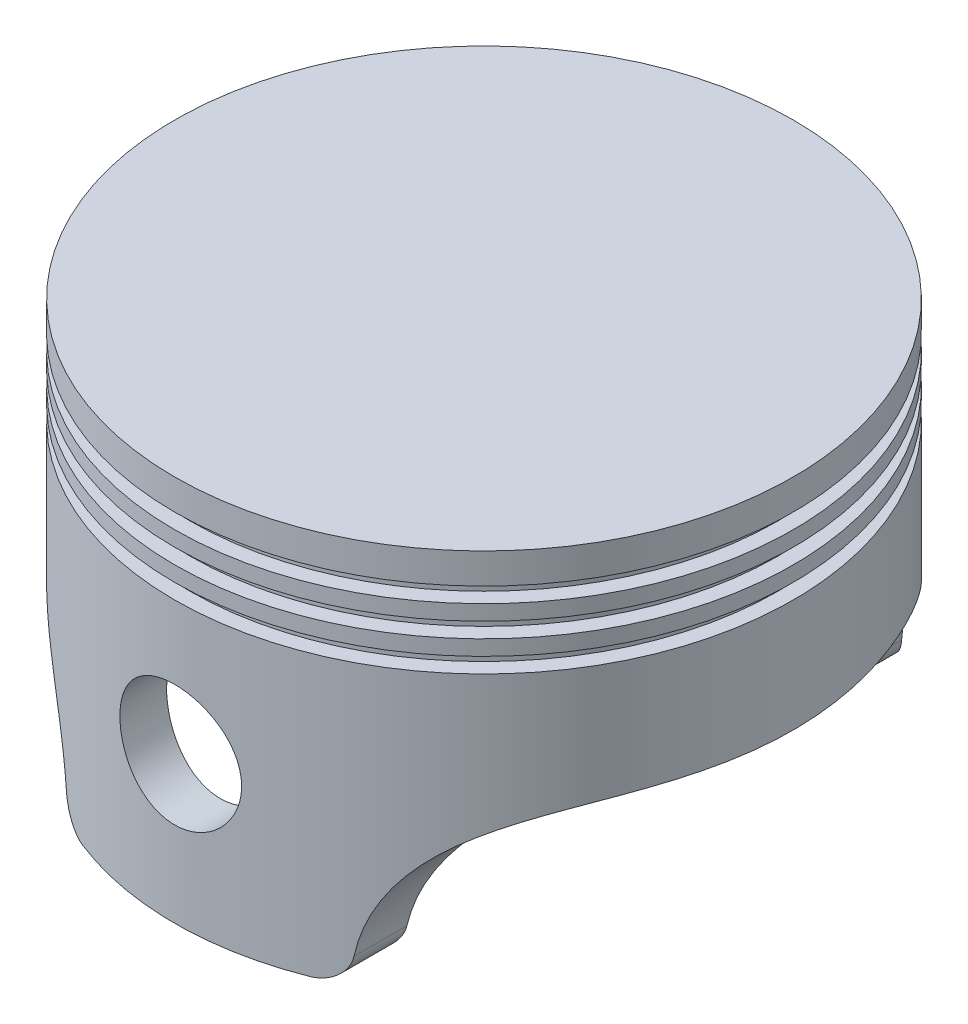
from build123d import *

# Parameters (mm, degrees)
SKETCH2_R           = 50.8
BOSS_EXTRUDE1_DEPTH = 31.75
SHELL1_T            = -7.5
BOSS_EXTRUDE5_DEPTH = 28.5
SKETCH6_R           = 10
CUT_EXTRUDE2_DEPTH  = 79.545162168
SKETCH8_W           = 2.5
SKETCH8_H           = 2.5
FILLET1_R           = 2
FILLET2_R           = 5


with BuildPart() as part:
    # Sketch2 → Boss-Extrude1 (new, symmetric)
    with BuildSketch(Plane(origin=(0, 0, 0), x_dir=(1, 0, 0), z_dir=(0, 1, 0))):
        Circle(SKETCH2_R)
    extrude(amount=BOSS_EXTRUDE1_DEPTH, both=True)

    # Shell1
    shell1_openings = [part.faces().sort_by_distance(p)[0] for p in [
        (0, -31.75, 0),
    ]]
    offset(amount=SHELL1_T, openings=shell1_openings, kind=Kind.INTERSECTION)

    # Sketch4 → Boss-Extrude5 (add)
    with BuildSketch(Plane.XZ.offset(-24.25)):
        with BuildLine():
            Line((-42.645515591, 7.5), (42.645515591, 7.5))
            ThreePointArc((42.645515591, 7.5), (42.125248373, 10.017656887), (41.456483208, 12.5))
            Line((41.456483208, 12.5), (-41.456483208, 12.5))
            ThreePointArc((-41.456483208, 12.5), (-42.125248373, 10.017656887), (-42.645515591, 7.5))
        make_face()
    boss_extrude5 = extrude(amount=BOSS_EXTRUDE5_DEPTH)

    # Mirror1: Boss-Extrude5 across plane
    add(boss_extrude5.mirror(Plane.XY))

    # Sketch6 → Cut-Extrude2 (cut, symmetric)
    with BuildSketch(Plane.XY):
        with Locations((0, -7.75)):
            Circle(SKETCH6_R)
        with BuildLine():
            Line((50.8, -31.75), (50.8, -4.25))
            ThreePointArc((50.8, -4.25), (31.354563517, -12.304563517), (23.3, -31.75))
            Line((23.3, -31.75), (50.8, -31.75))
        make_face()
    cut_extrude2 = extrude(amount=CUT_EXTRUDE2_DEPTH, both=True, mode=Mode.SUBTRACT)

    # Mirror2: Cut-Extrude2 across plane
    add(cut_extrude2.mirror(Plane(origin=(0, 0, 0), x_dir=(0, 0, 1), z_dir=(1, 0, 0))), mode=Mode.SUBTRACT)

    # Sketch8 → Cut-Revolve3 (revolve, cut)
    with BuildSketch(Plane.XY):
        with Locations((-49.55, 25.5)):
            Rectangle(SKETCH8_W, SKETCH8_H)
        with Locations((-49.55, 20.5)):
            Rectangle(SKETCH8_W, SKETCH8_H)
        with Locations((-49.55, 15.5)):
            Rectangle(SKETCH8_W, SKETCH8_H)
    revolve(axis=Axis((0, 0, 0), (0, 1, 0)), mode=Mode.SUBTRACT)

    # Fillet1
    fillet1_edges = [part.edges().sort_by_distance(p)[0] for p in [
        (0, 24.25, -43.3),
        (0, 24.25, 43.3),
        (-43.3, 24.25, 0),
        (43.13606858, 24.25, 3.764251248),
    ]]
    fillet(fillet1_edges, radius=FILLET1_R)

    # Fillet2
    fillet2_edges = [part.edges().sort_by_distance(p)[0] for p in [
        (-23.3, -31.75, -40.819009777),
        (23.3, -31.75, -40.819009777),
        (-23.3, -31.75, 40.819009777),
        (23.3, -31.75, 40.819009777),
    ]]
    fillet(fillet2_edges, radius=FILLET2_R)


solid = part.part
